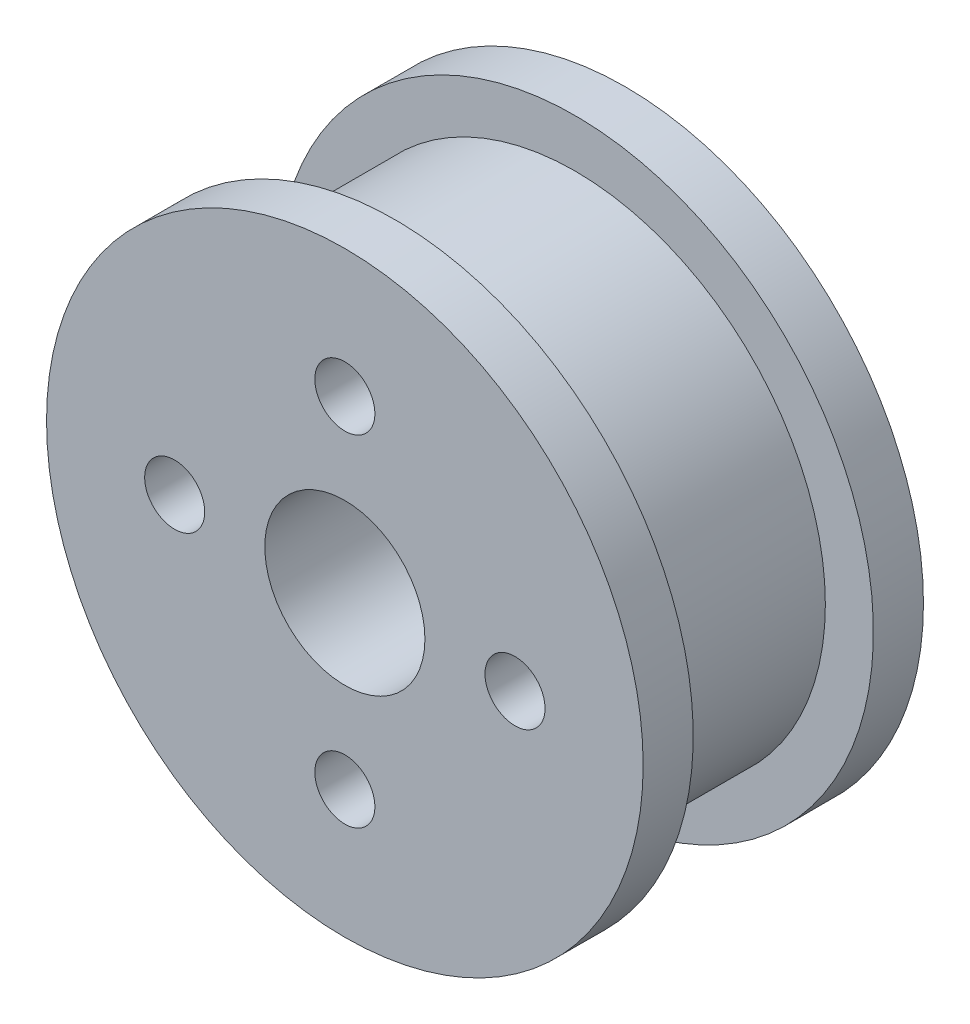
from build123d import *

# Parameters (mm, degrees)
SKETCH1_R           = 14.9
SKETCH1_R_2         = 4
BOSS_EXTRUDE1_DEPTH = 14
SKETCH2_R           = 14.9
SKETCH2_R_2         = 12.5
CUT_EXTRUDE1_DEPTH  = 9
SKETCH3_R           = 1.5
CUT_EXTRUDE2_DEPTH  = 26.298616563


with BuildPart() as part:
    # Sketch1 → Boss-Extrude1 (new body)
    with BuildSketch(Plane.XY):
        Circle(SKETCH1_R)
        Circle(SKETCH1_R_2, mode=Mode.SUBTRACT)
    extrude(amount=BOSS_EXTRUDE1_DEPTH)

    # Sketch2 → Cut-Extrude1 (cut)
    with BuildSketch(Plane(origin=(0, 0, 2.5), x_dir=(-1, 0, 0), z_dir=(0, 0, -1))):
        Circle(SKETCH2_R)
        Circle(SKETCH2_R_2, mode=Mode.SUBTRACT)
    extrude(amount=-CUT_EXTRUDE1_DEPTH, mode=Mode.SUBTRACT)

    # Sketch3 → Cut-Extrude2 (cut, through all)
    with BuildSketch(Plane(origin=(0, 0, 0), x_dir=(-1, 0, 0), z_dir=(0, 0, -1))):
        with Locations((8.5, 0)):
            Circle(SKETCH3_R)
        with Locations((0, 8.5)):
            Circle(SKETCH3_R)
        with Locations((0, -8.5)):
            Circle(SKETCH3_R)
        with Locations((-8.5, 0)):
            Circle(SKETCH3_R)
    extrude(amount=-CUT_EXTRUDE2_DEPTH, mode=Mode.SUBTRACT)


solid = part.part
